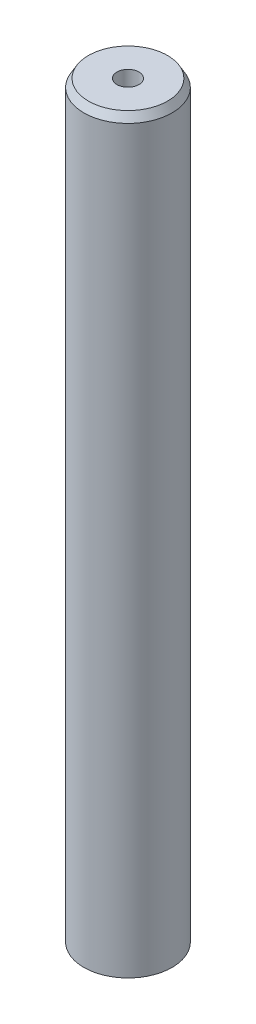
from build123d import *
from OCP.BRepFilletAPI import BRepFilletAPI_MakeChamfer

# Parameters (mm, degrees)
SKETCH1_R           = 5
BOSS_EXTRUDE1_DEPTH = 85.277457843
SKETCH2_R           = 1.24344375
CUT_EXTRUDE1_DEPTH  = 86.570116373
CHAMFER1_SIZE       = 0.896032442
CHAMFER1_SIZE2      = 0.517324572


with BuildPart() as part:
    # Sketch1 → Boss-Extrude1 (new body)
    with BuildSketch(Plane(origin=(0, 0, 0), x_dir=(1, 0, 0), z_dir=(0, 1, 0))):
        Circle(SKETCH1_R)
    extrude(amount=BOSS_EXTRUDE1_DEPTH)

    # Sketch2 → Cut-Extrude1 (cut, through all)
    with BuildSketch(Plane(origin=(0, 0, 0), x_dir=(1, 0, 0), z_dir=(0, 1, 0))):
        Circle(SKETCH2_R)
    extrude(amount=CUT_EXTRUDE1_DEPTH, mode=Mode.SUBTRACT)

    # Chamfer1: one chamfer whose edges measure the first distance from different faces: ONE call of the kernel's chamfer builder (chamfer() names one face for all edges)
    chamfer1_edges_1 = [part.edges().sort_by_distance(p)[0] for p in [
        (-5, 85.277457843, 0),
    ]]
    chamfer1_side_1 = [part.faces().sort_by_distance(p)[0] for p in [
        (-5, 42.638728921, 0),
    ]]
    chamfer1_edges_2 = [part.edges().sort_by_distance(p)[0] for p in [
        (-5, 0, 0),
    ]]
    chamfer1_side_2 = [part.faces().sort_by_distance(p)[0] for p in [
        (-4.858578644, 0, 0),
    ]]
    chamfer1 = BRepFilletAPI_MakeChamfer(part.part.solid().wrapped)
    for e in chamfer1_edges_1:
        chamfer1.Add(CHAMFER1_SIZE, CHAMFER1_SIZE2, e.wrapped, chamfer1_side_1[0].wrapped)  # the first distance lies on this face
    for e in chamfer1_edges_2:
        chamfer1.Add(CHAMFER1_SIZE, CHAMFER1_SIZE2, e.wrapped, chamfer1_side_2[0].wrapped)  # the first distance lies on this face
    add(Compound.cast(chamfer1.Shape()), mode=Mode.REPLACE)


solid = part.part
